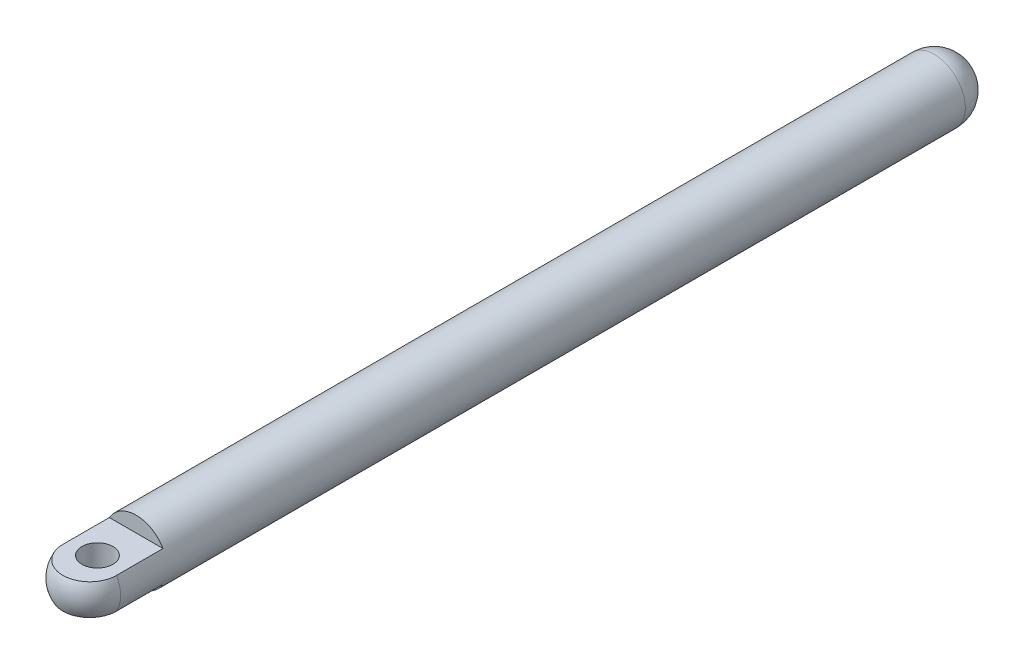
from build123d import *
from build123d.topology import SkipClean

# Parameters (mm, degrees)
SZKIC1_R                    = 4
DODANIE_WYCI_GNI_CIE1_DEPTH = 110
ZAOKR_GLENIE6_R             = 4
WYTNIJ_WYCI_GNI_CIE4_START  = -2
SZKIC2_W                    = 8
SZKIC2_H                    = 10
WYTNIJ_WYCI_GNI_CIE4_DEPTH  = 2
WYTNIJ_WYCI_GNI_CIE5_START  = -4
SZKIC5_W                    = 6.92820323
SZKIC5_H                    = 10
WYTNIJ_WYCI_GNI_CIE5_DEPTH  = 2
WYTNIJ_WYCI_GNI_CIE6_REACH  = 112.236
SZKIC6_R                    = 2
DODANIE_WYCI_GNI_CIE2_START = 7
SZKIC8_R                    = 4
DODANIE_WYCI_GNI_CIE2_DEPTH = 7
ZAOKR_GLENIE7_R             = 4


with BuildPart() as part:
    # Szkic1 → Dodanie-wyciągnięcie1 (new body)
    with BuildSketch(Plane.XY):
        Circle(SZKIC1_R)
    extrude(amount=DODANIE_WYCI_GNI_CIE1_DEPTH)

    # Zaokrąglenie6
    zaokr_glenie6_edges = [part.edges().sort_by_distance(p)[0] for p in [
        (-4, 0, 110),
    ]]
    fillet(zaokr_glenie6_edges, radius=ZAOKR_GLENIE6_R)

    # Szkic2 → Wytnij-wyciągnięcie4 (cut)
    with BuildSketch(Plane(origin=(0, 0, 0), x_dir=(1, 0, 0), z_dir=(0, 1, 0)).offset(WYTNIJ_WYCI_GNI_CIE4_START)):
        with Locations((0, -105)):
            Rectangle(SZKIC2_W, SZKIC2_H)
    extrude(amount=-WYTNIJ_WYCI_GNI_CIE4_DEPTH, mode=Mode.SUBTRACT)

    # Szkic5 → Wytnij-wyciągnięcie5 (cut)
    with BuildSketch(Plane.XZ.offset(2).offset(WYTNIJ_WYCI_GNI_CIE5_START)):
        with Locations((0, 105)):
            Rectangle(SZKIC5_W, SZKIC5_H)
    extrude(amount=-WYTNIJ_WYCI_GNI_CIE5_DEPTH, mode=Mode.SUBTRACT)

    # Szkic6 → Wytnij-wyciągnięcie6 (cut, up to next)
    with BuildSketch(Plane.XZ.offset(2), mode=Mode.PRIVATE) as wytnij_wyci_gni_cie6_sk1:
        with Locations((0, 105)):
            Circle(SZKIC6_R)
    wytnij_wyci_gni_cie6_tool1 = extrude(wytnij_wyci_gni_cie6_sk1.sketch, amount=-WYTNIJ_WYCI_GNI_CIE6_REACH, mode=Mode.PRIVATE) & part.part
    add(wytnij_wyci_gni_cie6_tool1.solids().sort_by_distance((0, -2, 105))[0], mode=Mode.SUBTRACT)

    # Szkic8 → Dodanie-wyciągnięcie2 (add)
    with SkipClean():  # the faces are left unmerged after this step: merging them gives an invalid solid
        with BuildSketch(Plane(origin=(0, 0, 0), x_dir=(-1, 0, 0), z_dir=(0, 0, -1)).offset(DODANIE_WYCI_GNI_CIE2_START)):
            Circle(SZKIC8_R)
        extrude(amount=-DODANIE_WYCI_GNI_CIE2_DEPTH)

    # Zaokrąglenie7
    zaokr_glenie7_edges = [part.edges().sort_by_distance(p)[0] for p in [
        (4, 0, -7),
    ]]
    fillet(zaokr_glenie7_edges, radius=ZAOKR_GLENIE7_R)


solid = part.part
